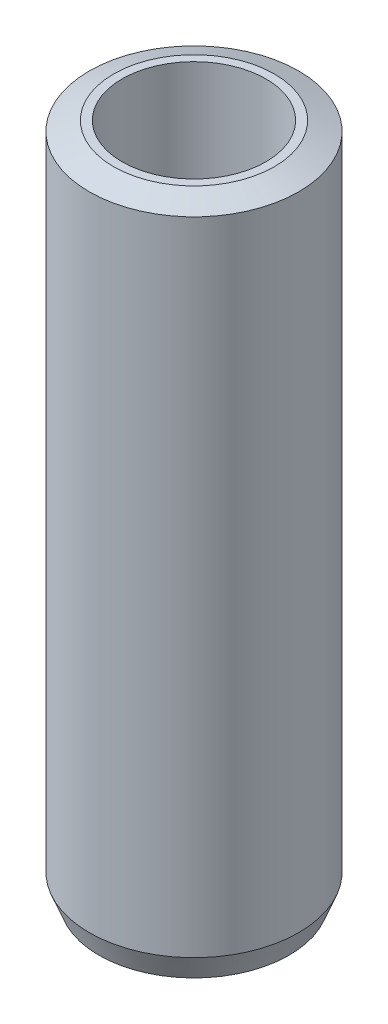
from build123d import *
from OCP.BRepFilletAPI import BRepFilletAPI_MakeChamfer

# Parameters (mm, degrees)
SKETCH1_R           = 45
BOSS_EXTRUDE1_DEPTH = 290.302187475
SKETCH2_R           = 30.902431237
CUT_EXTRUDE1_DEPTH  = 298.195827785
CHAMFER1_SIZE       = 4.107084406
CHAMFER1_SIZE2      = 10.454261867


with BuildPart() as part:
    # Sketch1 → Boss-Extrude1 (new body)
    with BuildSketch(Plane(origin=(0, 0, 0), x_dir=(1, 0, 0), z_dir=(0, 1, 0))):
        Circle(SKETCH1_R)
    extrude(amount=BOSS_EXTRUDE1_DEPTH)

    # Sketch2 → Cut-Extrude1 (cut, through all)
    with BuildSketch(Plane(origin=(0, 0, 0), x_dir=(1, 0, 0), z_dir=(0, 1, 0))):
        Circle(SKETCH2_R)
    extrude(amount=CUT_EXTRUDE1_DEPTH, mode=Mode.SUBTRACT)

    # Chamfer1: one chamfer whose edges measure the first distance from different faces: ONE call of the kernel's chamfer builder (chamfer() names one face for all edges)
    chamfer1_edges_1 = [part.edges().sort_by_distance(p)[0] for p in [
        (-45, 290.302187475, 0),
    ]]
    chamfer1_side_1 = [part.faces().sort_by_distance(p)[0] for p in [
        (-45, 145.151093738, 0),
    ]]
    chamfer1_edges_2 = [part.edges().sort_by_distance(p)[0] for p in [
        (-45, 0, 0),
    ]]
    chamfer1_side_2 = [part.faces().sort_by_distance(p)[0] for p in [
        (-43.727207794, 0, 0),
    ]]
    chamfer1 = BRepFilletAPI_MakeChamfer(part.part.solid().wrapped)
    for e in chamfer1_edges_1:
        chamfer1.Add(CHAMFER1_SIZE, CHAMFER1_SIZE2, e.wrapped, chamfer1_side_1[0].wrapped)  # the first distance lies on this face
    for e in chamfer1_edges_2:
        chamfer1.Add(CHAMFER1_SIZE, CHAMFER1_SIZE2, e.wrapped, chamfer1_side_2[0].wrapped)  # the first distance lies on this face
    add(Compound.cast(chamfer1.Shape()), mode=Mode.REPLACE)


solid = part.part
